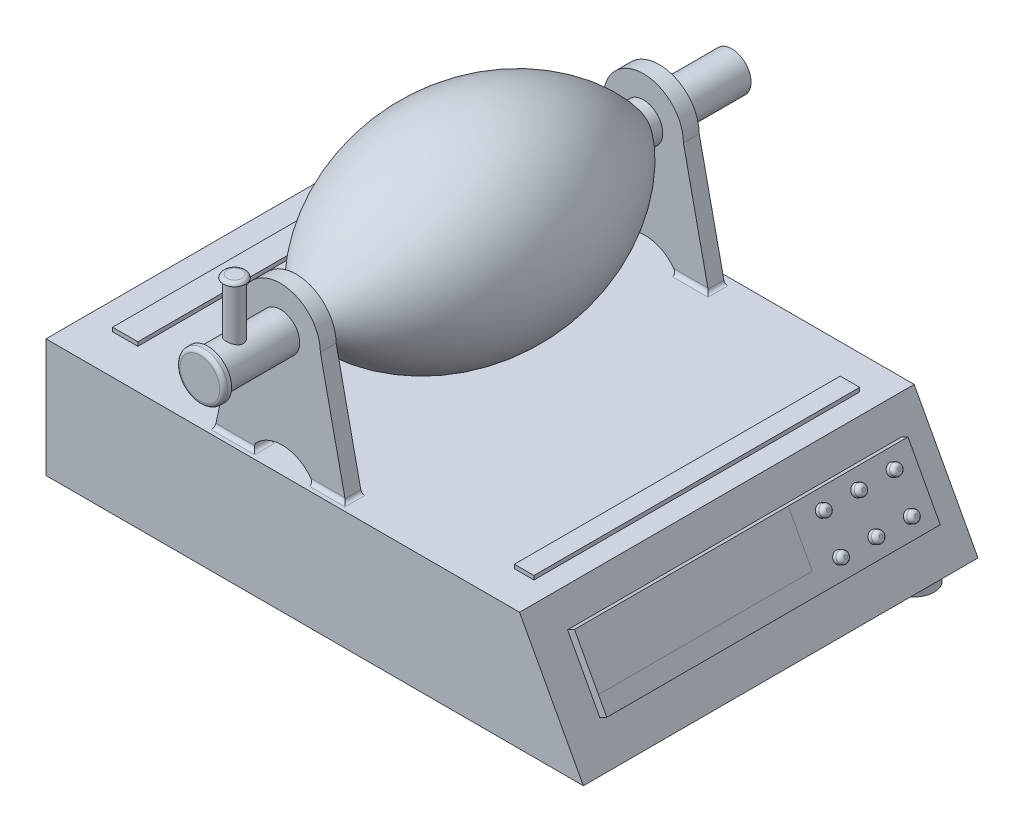
from build123d import *

# Parameters (mm, degrees)
SKETCH1_W           = 152.4
SKETCH1_H           = 38.1
BOSS_EXTRUDE1_DEPTH = 63.5
BOSS_EXTRUDE2_START = -2.54
SKETCH2_R           = 5.581324081
BOSS_EXTRUDE2_DEPTH = 5.08
SKETCH5_R           = 7.649182697
BOSS_EXTRUDE3_DEPTH = 2.54
SKETCH6_W           = 6.28032652
SKETCH6_H           = 104.845098628
SKETCH6_W_2         = 8.141164008
SKETCH6_H_2         = 103.449470512
BOSS_EXTRUDE4_DEPTH = 1.27
SKETCH10_R          = 6.338835005
BOSS_EXTRUDE5_DEPTH = 6.35
SKETCH11_W          = 107.32219814
SKETCH11_H          = 21.904665517
BOSS_EXTRUDE6_DEPTH = 2.54
SKETCH14_R          = 1.776023081
BOSS_EXTRUDE7_DEPTH = 5.08
FILLET2_R           = 1.27
BOSS_EXTRUDE8_START = 55.88
SKETCH15_R          = 2.761949727
BOSS_EXTRUDE8_DEPTH = 22.86
SKETCH16_R          = 3.605337553
BOSS_EXTRUDE9_DEPTH = 1.016
FILLET3_R           = 1.27
FILLET4_R           = 1.27
FILLET5_R           = 1.27


with BuildPart() as part:
    # Sketch1 → Boss-Extrude1 (new, symmetric)
    with BuildSketch(Plane.XY):
        Rectangle(SKETCH1_W, SKETCH1_H)
        Polygon((96.745392491, -19.05), (76.2, -19.05), (76.2, 19.05), align=None)
    extrude(amount=BOSS_EXTRUDE1_DEPTH, both=True)

    # Sketch2 → Boss-Extrude2 (add)
    with BuildSketch(Plane.XY.offset(63.5).offset(BOSS_EXTRUDE2_START)):
        with BuildLine():
            Line((-16.166869298, 19.05), (-12.783535661, 19.05))
            ThreePointArc((-12.783535661, 19.05), (-2.752490883, 24.914392577), (7.278553894, 19.05))
            Line((7.278553894, 19.05), (9.562869298, 19.05))
            Line((9.562869298, 19.05), (17.708520628, 19.05))
            Line((17.708520628, 19.05), (9.562869298, 56.854489091))
            ThreePointArc((9.562869298, 56.854489091), (-3.302, 69.719358389), (-16.166869298, 56.854489091))
            Line((-16.166869298, 56.854489091), (-24.312520628, 19.05))
            Line((-24.312520628, 19.05), (-16.166869298, 19.05))
        make_face()
        with Locations((-3.302, 56.854489091)):
            Circle(SKETCH2_R, mode=Mode.SUBTRACT)
    boss_extrude2 = extrude(amount=-BOSS_EXTRUDE2_DEPTH)

    # Mirror1: Boss-Extrude2 across plane
    add(boss_extrude2.mirror(Plane.XY))

    # Sketch6 → Boss-Extrude4 (add)
    with BuildSketch(Plane(origin=(0, 19.05, 0), x_dir=(1, 0, 0), z_dir=(0, 1, 0))):
        with Locations((66.397406276, 0.214065446)):
            Rectangle(SKETCH6_W, SKETCH6_H)
        with Locations((-63.396008473, 0.911879504)):
            Rectangle(SKETCH6_W_2, SKETCH6_H_2)
    extrude(amount=BOSS_EXTRUDE4_DEPTH)

    # Sketch10 → Boss-Extrude5 (add)
    with BuildSketch(Plane.XZ.offset(19.05)):
        with Locations(Location((-62.000759301, 50.825577826, 0), (0, 0, 90))):
            Circle(SKETCH10_R)
        with Locations(Location((83.487825481, 50.825577826, 0), (0, 0, 90))):
            Circle(SKETCH10_R)
        with Locations(Location((86.548264966, -53.229364688, 0), (0, 0, 90))):
            Circle(SKETCH10_R)
        with Locations(Location((-64.825780365, -54.877293642, 0), (0, 0, 90))):
            Circle(SKETCH10_R)
    extrude(amount=BOSS_EXTRUDE5_DEPTH)

    # Sketch11 → Boss-Extrude6 (add)
    with BuildSketch(Plane(origin=(66.992090278, 36.125427522, 0), x_dir=(0, 0, -1), z_dir=(0.8801815566196112, 0.47463715339897106, 0))):
        with Locations((1.188989576, -39.659583599)):
            Rectangle(SKETCH11_W, SKETCH11_H)
    extrude(amount=BOSS_EXTRUDE6_DEPTH)

    # Sketch14 → Boss-Extrude7 (add)
    with BuildSketch(Plane(origin=(66.992090278, 36.125427522, 0), x_dir=(0, 0, -1), z_dir=(0.8801815566196111, 0.474637153398971, 0))):
        with Locations(Location((24.712283214, -33.579107671, 0), (0, 0, 90))):
            Circle(SKETCH14_R)
        with Locations(Location((36.108431317, -33.579107671, 0), (0, 0, 90))):
            Circle(SKETCH14_R)
        with Locations(Location((47.50457942, -33.579107671, 0), (0, 0, 90))):
            Circle(SKETCH14_R)
        with Locations(Location((24.712283214, -45.271259621, 0), (0, 0, 90))):
            Circle(SKETCH14_R)
        with Locations(Location((36.108431317, -45.271259621, 0), (0, 0, 90))):
            Circle(SKETCH14_R)
        with Locations(Location((47.50457942, -45.271259621, 0), (0, 0, 90))):
            Circle(SKETCH14_R)
    extrude(amount=BOSS_EXTRUDE7_DEPTH)

    # Fillet2
    fillet2_edges = [part.edges().sort_by_distance(p)[0] for p in [
        (88.244271204, 7.417650241, -24.712283214),
        (88.244271204, 7.417650241, -36.108431317),
        (88.244271204, 7.417650241, -47.50457942),
        (93.793800923, -2.873566262, -24.712283214),
        (93.793800923, -2.873566262, -36.108431317),
        (93.793800923, -2.873566262, -47.50457942),
    ]]
    fillet(fillet2_edges, radius=FILLET2_R)

    # Fillet5
    fillet5_edges = [part.edges().sort_by_distance(p)[0] for p in [
        (17.708520628, 19.05, 58.42),
        (-12.783535661, 19.05, 58.42),
        (-18.548028145, 19.05, 60.96),
        (12.493537261, 19.05, 60.96),
        (-18.548028145, 19.05, -55.88),
        (12.493537261, 19.05, -55.88),
        (-12.783535661, 19.05, -58.42),
        (17.708520628, 19.05, -58.42),
    ]]
    fillet(fillet5_edges, radius=FILLET5_R)


with BuildPart() as body_2:
    # Sketch4 → Revolve2 (revolve)
    with BuildSketch(Plane(origin=(-3.302, 0, 0), x_dir=(0, 0, -1), z_dir=(1, 0, 0)), mode=Mode.PRIVATE) as revolve2_sk:
        with BuildLine():
            Line((-84.317378873, 56.213738137), (-84.317378873, 50.000852268))
            Line((-84.317378873, 50.000852268), (-52.63661476, 50.000852268))
            ThreePointArc((-52.63661476, 50.000852268), (0, 24.220932902), (52.63661476, 50.000852268))
            Line((52.63661476, 50.000852268), (84.317378873, 50.000852268))
            Line((84.317378873, 50.000852268), (84.317378873, 56.213738137))
            Line((84.317378873, 56.213738137), (-84.317378873, 56.213738137))
        make_face()
    revolve(revolve2_sk.sketch.rotate(Axis((-3.302, 56.213738137, 84.317378873), (0, 0, -1)), 270), axis=Axis((-3.302, 56.213738137, 84.317378873), (0, 0, -1)))

    # Sketch5 → Boss-Extrude3 (add)
    with BuildSketch(Plane.XY.offset(84.317378873)):
        with Locations((-3.302, 56.213738137)):
            Circle(SKETCH5_R)
    extrude(amount=BOSS_EXTRUDE3_DEPTH)

    # Sketch15 → Boss-Extrude8 (add)
    with BuildSketch(Plane(origin=(0, 0, 0), x_dir=(1, 0, 0), z_dir=(0, 1, 0)).offset(BOSS_EXTRUDE8_START)):
        with Locations(Location((-3.203353786, -75.829029675, 0), (0, 0, 90))):
            Circle(SKETCH15_R)
    extrude(amount=BOSS_EXTRUDE8_DEPTH)

    # Sketch16 → Boss-Extrude9 (add)
    with BuildSketch(Plane(origin=(0, 78.74, 0), x_dir=(1, 0, 0), z_dir=(0, 1, 0))):
        with Locations(Location((-3.203353786, -75.829029675, 0), (0, 0, 270))):
            Circle(SKETCH16_R)
    extrude(amount=BOSS_EXTRUDE9_DEPTH)

    # Fillet3
    fillet3_edges = [body_2.edges().sort_by_distance(p)[0] for p in [
        (-10.951182697, 56.213738137, 86.857378873),
    ]]
    fillet(fillet3_edges, radius=FILLET3_R)

    # Fillet4
    # the kernel refuses this fillet: 1.27 mm, written as the material it takes off along each edge
    with BuildSketch(Plane(origin=(-3.203353786, 79.756, 75.829029675), x_dir=(0, 0, 1), z_dir=(-1, 0, 0))) as fillet4_piece_1:
        with BuildLine():
            CenterArc((2.360996764, -1.27), FILLET4_R, 11.536959033, 78.463040967)
            Line((2.360996764, 0), (2.360996764, 0.0254))
            Line((2.360996764, 0.0254), (3.605337553, 0.0254))
            Line((3.605337553, 0.0254), (3.630737553, 0))
            ThreePointArc((3.630737553, 0), (3.630737553, -0.508), (3.630224369, -1.01092))
            Line((3.630224369, -1.01092), (3.605337553, -1.016))
        make_face()
    revolve(axis=Axis((-3.203353786, 79.756, 75.829029675), (0, 1, 0)), mode=Mode.SUBTRACT)


solid = Compound([part.part, body_2.part])
